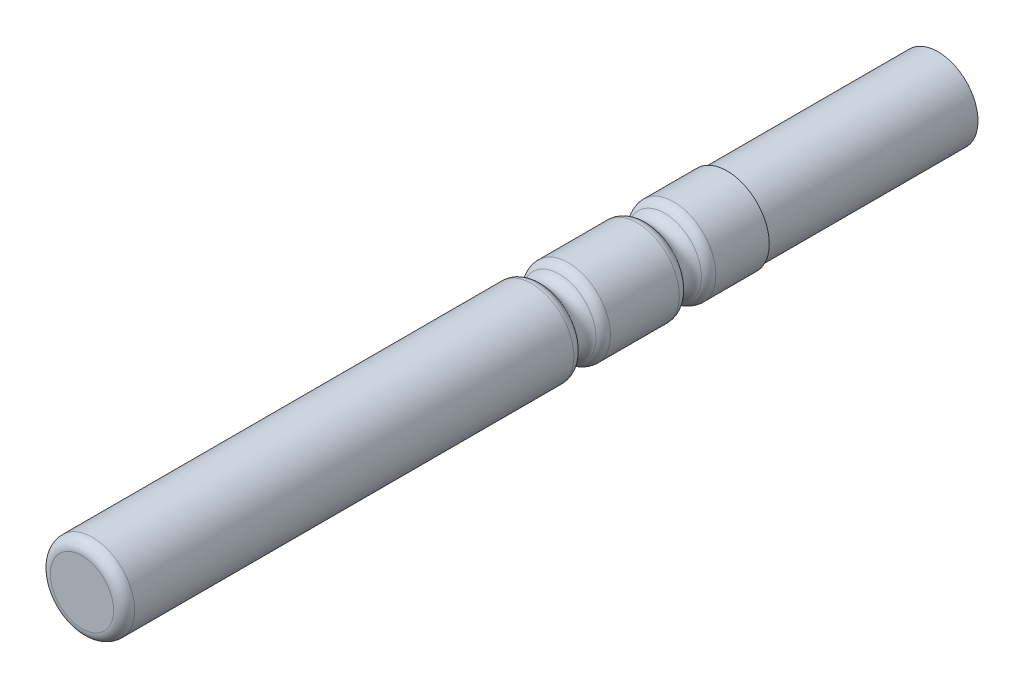
from build123d import *

# Parameters (mm, degrees)
SKETCH1_R           = 2
BOSS_EXTRUDE1_DEPTH = 30.6
SKETCH2_R           = 0.5
SKETCH3_R           = 1.9
BOSS_EXTRUDE2_DEPTH = 10


with BuildPart() as part:
    # Sketch1 → Boss-Extrude1 (new body)
    with BuildSketch(Plane.XY):
        Circle(SKETCH1_R)
    extrude(amount=BOSS_EXTRUDE1_DEPTH)

    # Sketch2 → Cut-Revolve1 (revolve, cut)
    with BuildSketch(Plane(origin=(0, 0, 0), x_dir=(0, 0, -1), z_dir=(1, 0, 0))):
        with Locations((-3.4, 2)):
            Circle(SKETCH2_R)
        with Locations((-8.4, 2)):
            Circle(SKETCH2_R)
    revolve(axis=Axis((0, 0, 0), (0, 0, 1)), mode=Mode.SUBTRACT)

    # Fillet1: read off the stored shape, not the designer's step
    # Fillet1 outline → Fillet1 (revolve, cut)
    with BuildSketch(Plane.XZ):
        with BuildLine():
            ThreePointArc((1.75, 2.966987298), (1.933012702, 2.783974596), (2, 2.533974596))
            Line((2, 2.533974596), (2, 2.966987298))
            Line((2, 2.966987298), (1.75, 2.966987298))
        make_face()
        with BuildLine():
            ThreePointArc((2, 4.266025404), (1.933012702, 4.016025404), (1.75, 3.833012702))
            Line((1.75, 3.833012702), (2, 3.833012702))
            Line((2, 3.833012702), (2, 4.266025404))
        make_face()
        with BuildLine():
            ThreePointArc((1.75, 7.966987298), (1.933012702, 7.783974596), (2, 7.533974596))
            Line((2, 7.533974596), (2, 7.966987298))
            Line((2, 7.966987298), (1.75, 7.966987298))
        make_face()
        with BuildLine():
            ThreePointArc((2, 9.266025404), (1.933012702, 9.016025404), (1.75, 8.833012702))
            Line((1.75, 8.833012702), (2, 8.833012702))
            Line((2, 8.833012702), (2, 9.266025404))
        make_face()
        with BuildLine():
            Line((2, 30.1), (2, 30.6))
            Line((2, 30.6), (1.5, 30.6))
            ThreePointArc((1.5, 30.6), (1.853553391, 30.453553391), (2, 30.1))
        make_face()
    revolve(axis=Axis((0, 0, 0), (0, 0, 1)), mode=Mode.SUBTRACT)

    # Sketch3 → Boss-Extrude2 (add)
    with BuildSketch(Plane.XY):
        Circle(SKETCH3_R)
    extrude(amount=-BOSS_EXTRUDE2_DEPTH)


solid = part.part
